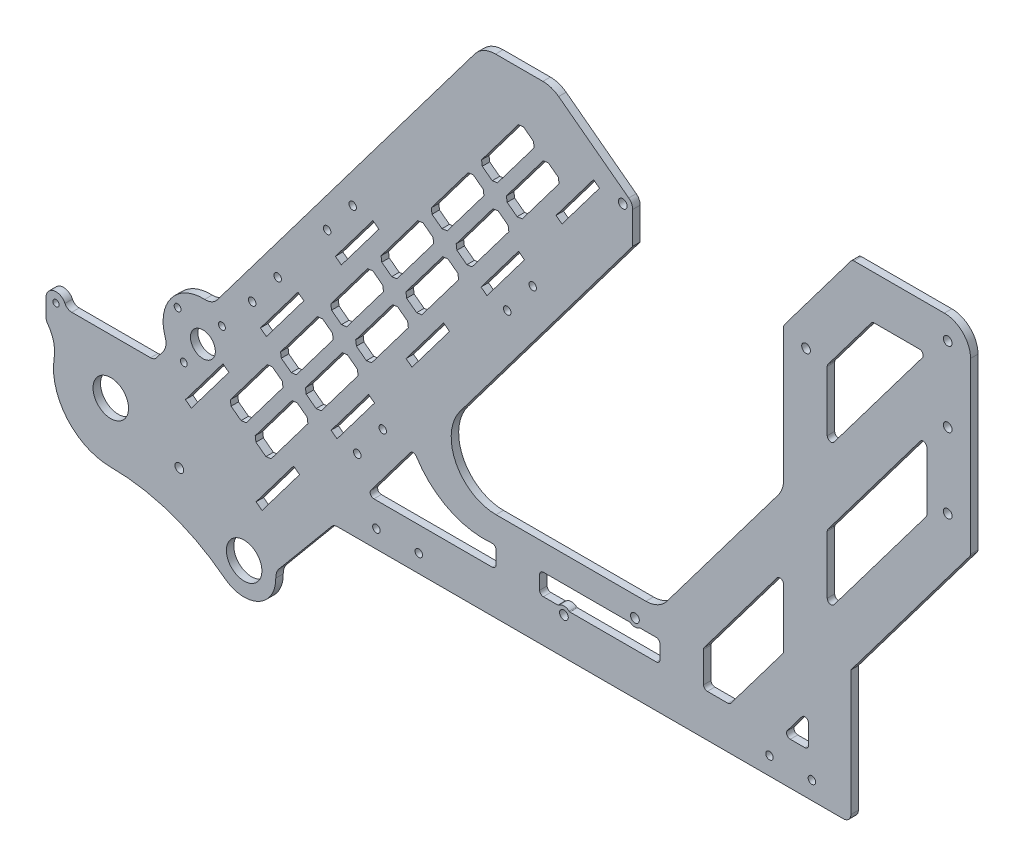
from build123d import *

# Parameters (mm, degrees)
ESBO_O1_R                 = 14.25
RESSALTO_EXTRUS_O1_DEPTH  = 6
RESSALTO_EXTRUS_O2_DEPTH  = 6
FILETE1_R                 = 12
FILETE2_R                 = 6
CORTE_EXTRUS_O1_DEPTH     = 10
FILETE3_R                 = 6
RESSALTO_EXTRUS_O3_DEPTH  = 6
ESBO_O6_R                 = 2.5
CORTE_EXTRUS_O2_DEPTH     = 10
FILETE4_R                 = 6
CORTE_EXTRUS_O3_DEPTH     = 864.46704654
ESBO_O8_R                 = 16
ESBO_O8_R_2               = 14.25
RESSALTO_EXTRUS_O4_DEPTH  = 6
CORTE_EXTRUS_O4_DEPTH     = 983.515139832
FILETE5_R                 = 55
CORTE_EXTRUS_O5_DEPTH     = 983.515139832
FILETE8_R                 = 21
RESSALTO_EXTRUS_O5_DEPTH  = 6
ESBO_O13_R                = 2.5
CORTE_EXTRUS_O7_DEPTH     = 983.515139832
CORTE_EXTRUS_O8_DEPTH     = 983.515139832
FILETE10_R                = 21
FILETE11_R                = 21
FILETE12_R                = 21
RESSALTO_EXTRUS_O6_DEPTH  = 6
FILETE13_R                = 21
CHANFRO1_SIZE             = 55
CHANFRO1_SIZE2            = 72.987465189
CORTE_EXTRUS_O10_DEPTH    = 983.515139832
FILETE15_R                = 3
RESSALTO_EXTRUS_O9_DEPTH  = 6
CORTE_EXTRUS_O12_DEPTH    = 983.515139832
FILETE16_R                = 3
ESBO_O22_W                = 96.57162865
ESBO_O22_H                = 17
CORTE_EXTRUS_O13_DEPTH    = 983.515139832
FILETE17_R                = 3
FILETE18_R                = 6
ESBO_O23_R                = 2.5
CORTE_EXTRUS_O14_DEPTH    = 983.515139832
RESSALTO_EXTRUS_O10_DEPTH = 6
FILETE19_R                = 12
ESBO_O25_R                = 10
CORTE_EXTRUS_O15_DEPTH    = 983.515139832
RESSALTO_EXTRUS_O11_DEPTH = 6
RESSALTO_EXTRUS_O12_DEPTH = 6
ESBO_O30_R                = 3.5
CORTE_EXTRUS_O17_DEPTH    = 983.515139832
ESBO_O32_R                = 3.5
CORTE_EXTRUS_O19_DEPTH    = 983.515139832
ESBO_O33_R                = 6.35
ESBO_O33_R_2              = 3.5
RESSALTO_EXTRUS_O14_DEPTH = 6
FILETE20_R                = 1
ESBO_O34_R                = 2.75
CORTE_EXTRUS_O20_DEPTH    = 983.515139832
ESBO_O35_R                = 2.75
RESSALTO_EXTRUS_O15_DEPTH = 6
ESBO_O37_R                = 3
CORTE_EXTRUS_O22_DEPTH    = 983.515139832
ESBO_O41_R                = 3.5
CORTE_EXTRUS_O26_DEPTH    = 983.515139832
ESBO_O44_R                = 16
CORTE_EXTRUS_O28_DEPTH    = 10
CORTE_EXTRUS_O29_DEPTH    = 864.46704654
ESBO_O46_R                = 3
CORTE_EXTRUS_O30_DEPTH    = 864.46704654
ESBO_O48_R                = 3.5
CORTE_EXTRUS_O31_DEPTH    = 864.46704654
CHANFRO2_SIZE             = 3


with BuildPart() as part:
    # Esboço1 → Ressalto-extrusão1 (new body)
    with BuildSketch(Plane.XY):
        with BuildLine():
            Line((0, 0), (52, 0))
            ThreePointArc((52, 0), (100.313395628, -8.084230776), (143.363260698, -31.456181952))
            ThreePointArc((143.363260698, -31.456181952), (172.156349944, -33.167061423), (183.983606557, -6.859551128))
            ThreePointArc((183.983606557, -6.859551128), (194.279022835, 32.360935307), (231, 49.560121003))
            Line((231, 49.560121003), (742, 49.560121003))
            Line((742, 49.560121003), (742, 441.560121003))
            Line((742, 441.560121003), (350.348102682, 441.560121003))
            Line((350.348102682, 441.560121003), (86.935657746, 92))
            Line((86.935657746, 92), (0, 92))
            Line((0, 92), (0, 0))
        make_face()
        with Locations((52, 48)):
            Circle(ESBO_O1_R, mode=Mode.SUBTRACT)
        with Locations((159, -11.439878997)):
            Circle(ESBO_O1_R, mode=Mode.SUBTRACT)
    extrude(amount=RESSALTO_EXTRUS_O1_DEPTH)

    # Esboço2 → Ressalto-extrusão2 (add, through all)
    with BuildSketch(Plane.XY.offset(6)):
        with BuildLine():
            Line((183.983606557, -6.859551128), (231, 49.560121003))
            ThreePointArc((231, 49.560121003), (194.279022835, 32.360935307), (183.983606557, -6.859551128))
        make_face()
    extrude(amount=-RESSALTO_EXTRUS_O2_DEPTH)

    # Filete1
    filete1_edges = [part.edges().sort_by_distance(p)[0] for p in [
        (183.983606557, -6.859551128, 3),
    ]]
    fillet(filete1_edges, radius=FILETE1_R)

    # Filete2
    filete2_edges = [part.edges().sort_by_distance(p)[0] for p in [
        (86.935657746, 92, 3),
        (231, 49.560121003, 3),
    ]]
    fillet(filete2_edges, radius=FILETE2_R)

    # Esboço3 → Corte-extrusão1 (cut)
    with BuildSketch(Plane.XY.offset(6)):
        with BuildLine():
            ThreePointArc((52, 0), (17.020473331, 16.126387664), (6.566746982, 53.198577652))
            ThreePointArc((6.566746982, 53.198577652), (5.818108209, 65.32928546), (0, 76))
            Line((0, 76), (0, 0))
            Line((0, 0), (52, 0))
        make_face()
    extrude(amount=-CORTE_EXTRUS_O1_DEPTH, mode=Mode.SUBTRACT)

    # Filete3
    filete3_edges = [part.edges().sort_by_distance(p)[0] for p in [
        (0, 76, 3),
    ]]
    fillet(filete3_edges, radius=FILETE3_R)

    # Esboço5 → Ressalto-extrusão3 (add, through all)
    with BuildSketch(Plane.XY.offset(6)):
        with BuildLine():
            Line((0, 92), (16, 92))
            ThreePointArc((16, 92), (8, 100), (0, 92))
        make_face()
    extrude(amount=-RESSALTO_EXTRUS_O3_DEPTH)

    # Esboço6 → Corte-extrusão2 (cut)
    with BuildSketch(Plane.XY.offset(6)):
        with Locations((8, 92)):
            Circle(ESBO_O6_R)
    extrude(amount=-CORTE_EXTRUS_O2_DEPTH, mode=Mode.SUBTRACT)

    # Filete4
    filete4_edges = [part.edges().sort_by_distance(p)[0] for p in [
        (16, 92, 3),
    ]]
    fillet(filete4_edges, radius=FILETE4_R)

    # Esboço7 → Corte-extrusão3 (cut, through all)
    with BuildSketch(Plane.XY.offset(6)):
        Polygon((168.599532162, 34.207607546), (198.69028332, 74.139383048), (203.48209638, 70.528492909), (173.391345223, 30.596717407), align=None)
        Polygon((228.781034478, 114.071158551), (258.871785635, 154.002934053), (263.663598695, 150.392043914), (233.572847538, 110.460268412), align=None)
        Polygon((288.962536793, 193.934709555), (319.05328795, 233.866485058), (323.845101011, 230.255594919), (293.754349853, 190.323819416), align=None)
        Polygon((349.144039108, 273.79826056), (379.234790266, 313.730036062), (384.026603326, 310.119145924), (353.935852168, 270.187370421), align=None)
        Polygon((409.325541423, 353.661811565), (439.416292581, 393.593587067), (444.208105641, 389.982696928), (414.117354483, 350.050921426), align=None)
        Polygon((111.896410949, 76.93647419), (141.987162107, 116.868249692), (146.778975167, 113.257359553), (116.688224009, 73.325584051), align=None)
        Polygon((172.077913264, 156.800025194), (202.168664422, 196.731800697), (206.960477482, 193.120910558), (176.869726324, 153.189135055), align=None)
        Polygon((232.259415579, 236.663576199), (262.350166737, 276.595351702), (267.141979797, 272.984461563), (237.05122864, 233.05268606), align=None)
    extrude(amount=-CORTE_EXTRUS_O3_DEPTH, mode=Mode.SUBTRACT)

    # Esboço9 → Corte-extrusão4 (cut, through all)
    with BuildSketch(Plane(origin=(0, 0, 0), x_dir=(-1, 0, 0), z_dir=(0, 0, -1))):
        Polygon((-592, 441.560121003), (-492, 441.560121003), (-250.862703967, 121.560121003), (-592, 121.560121003), align=None)
    extrude(amount=-CORTE_EXTRUS_O4_DEPTH, mode=Mode.SUBTRACT)

    # Filete5
    filete5_edges = [part.edges().sort_by_distance(p)[0] for p in [
        (250.862703967, 121.560121003, 3),
    ]]
    fillet(filete5_edges, radius=FILETE5_R)

    # Esboço10 → Corte-extrusão5 (cut, through all)
    with BuildSketch(Plane(origin=(0, 0, 0), x_dir=(-1, 0, 0), z_dir=(0, 0, -1))):
        with BuildLine():
            Line((-646, 49.560121003), (-742, 49.560121003))
            Line((-742, 49.560121003), (-742, 245.560121003))
            ThreePointArc((-742, 245.560121003), (-689.71858819, 217.13787766), (-646, 176.766415164))
            Line((-646, 176.766415164), (-646, 49.560121003))
        make_face()
    extrude(amount=-CORTE_EXTRUS_O5_DEPTH, mode=Mode.SUBTRACT)

    # Filete8
    filete8_edges = [part.edges().sort_by_distance(p)[0] for p in [
        (350.348102682, 441.560121003, 3),
        (742, 441.560121003, 3),
        (492, 441.560121003, 3),
    ]]
    fillet(filete8_edges, radius=FILETE8_R)

    # Esboço12 → Ressalto-extrusão5 (add, through all)
    with BuildSketch(Plane.XY.offset(6)):
        with BuildLine():
            Line((470.880516127, 420.560121003), (470.880516127, 388.554842699))
            ThreePointArc((470.880516127, 388.554842699), (467.677967693, 382.152932166), (460.634401511, 380.87662877))
            ThreePointArc((460.634401511, 380.87662877), (450.44071555, 379.947724736), (441.636873577, 374.725994882))
            Line((441.636873577, 374.725994882), (466.651861838, 407.922005517))
            ThreePointArc((466.651861838, 407.922005517), (469.795312886, 413.896723218), (470.880516127, 420.560121003))
        make_face()
    extrude(amount=-RESSALTO_EXTRUS_O5_DEPTH)

    # Esboço13 → Corte-extrusão7 (cut, through all)
    with BuildSketch(Plane.XY.offset(6)):
        with Locations((462.880516127, 388.554842699)):
            Circle(ESBO_O13_R)
    extrude(amount=-CORTE_EXTRUS_O7_DEPTH, mode=Mode.SUBTRACT)

    # Esboço14 → Corte-extrusão8 (cut, through all)
    with BuildSketch(Plane.XY.offset(6)):
        with BuildLine():
            Line((467.695036312, 394.943926779), (405.833257163, 441.560121003))
            Line((405.833257163, 441.560121003), (449.880516127, 441.560121003))
            ThreePointArc((449.880516127, 441.560121003), (464.729758531, 435.409363408), (470.880516127, 420.560121003))
            Line((470.880516127, 420.560121003), (470.880516127, 388.554842699))
            ThreePointArc((470.880516127, 388.554842699), (470.039991019, 392.124425203), (467.695036312, 394.943926779))
        make_face()
    extrude(amount=-CORTE_EXTRUS_O8_DEPTH, mode=Mode.SUBTRACT)

    # Filete10
    filete10_edges = [part.edges().sort_by_distance(p)[0] for p in [
        (405.833257163, 441.560121003, 3),
    ]]
    fillet(filete10_edges, radius=FILETE10_R)

    # Filete11
    filete11_edges = [part.edges().sort_by_distance(p)[0] for p in [
        (646, 176.766415164, 3),
    ]]
    fillet(filete11_edges, radius=FILETE11_R)

    # Filete12
    filete12_edges = [part.edges().sort_by_distance(p)[0] for p in [
        (742, 245.560121003, 3),
    ]]
    fillet(filete12_edges, radius=FILETE12_R)

    # Esboço16 → Ressalto-extrusão6 (add, through all)
    with BuildSketch(Plane.XY.offset(6)):
        Polygon((592, 254.264603165), (492, 121.560121003), (592, 121.560121003), align=None)
    extrude(amount=-RESSALTO_EXTRUS_O6_DEPTH)

    # Filete13
    filete13_edges = [part.edges().sort_by_distance(p)[0] for p in [
        (592, 254.264603165, 3),
        (492, 121.560121003, 3),
    ]]
    fillet(filete13_edges, radius=FILETE13_R)

    # Chanfro1
    chanfro1_edges = [part.edges().sort_by_distance(p)[0] for p in [
        (592, 441.560121003, 3),
    ]]
    chanfro1_side = [part.faces().sort_by_distance(p)[0] for p in [
        (656.5, 441.560121003, 3),
    ]]
    chamfer(chanfro1_edges, length=CHANFRO1_SIZE, length2=CHANFRO1_SIZE2, reference=chanfro1_side[0])

    # Esboço17 → Corte-extrusão10 (cut, through all)
    with BuildSketch(Plane.XY.offset(6)):
        Polygon((663.198220624, 406.560121003), (627, 358.523459772), (627, 300.396535273), (707, 406.560121003), align=None)
        Polygon((627, 243.900770475), (707, 350.064356205), (707, 293.568591407), (627, 187.405005677), align=None)
        Polygon((646, 106.12309249), (742, 233.519395365), (742, 283.519395365), (646, 156.12309249), align=None)
    extrude(amount=-CORTE_EXTRUS_O10_DEPTH, mode=Mode.SUBTRACT)

    # Filete15
    filete15_edges = [part.edges().sort_by_distance(p)[0] for p in [
        (592, 368.572655814, 3),
        (647, 441.560121003, 3),
        (627, 187.405005677, 3),
        (627, 243.900770475, 3),
        (707, 350.064356205, 3),
        (707, 293.568591407, 3),
        (742, 283.519395365, 3),
        (663.198220624, 406.560121003, 3),
        (707, 406.560121003, 3),
        (627, 300.396535273, 3),
        (627, 358.523459772, 3),
    ]]
    fillet(filete15_edges, radius=FILETE15_R)

    # Esboço20 → Ressalto-extrusão9 (add, through all)
    with BuildSketch(Plane.XY.offset(6)):
        Polygon((694.488580605, 220.46961229), (646, 156.12309249), (646, 192.12309249), align=None)
    extrude(amount=-RESSALTO_EXTRUS_O9_DEPTH)

    # Esboço21 → Corte-extrusão12 (cut, through all)
    with BuildSketch(Plane.XY.offset(6)):
        Polygon((592, 197.454201718), (527.747266571, 112.187944547), (527.747266571, 83.560121003), (548.747266571, 83.560121003), (592, 140.95843692), align=None)
        Polygon((591.319878949, 83.560121003), (612, 83.560121003), (612, 111.003568554), align=None)
    extrude(amount=-CORTE_EXTRUS_O12_DEPTH, mode=Mode.SUBTRACT)

    # Filete16
    filete16_edges = [part.edges().sort_by_distance(p)[0] for p in [
        (591.319878949, 83.560121003, 3),
        (612, 111.003568554, 3),
        (612, 83.560121003, 3),
        (592, 197.454201718, 3),
        (592, 140.95843692, 3),
        (548.747266571, 83.560121003, 3),
        (527.747266571, 83.560121003, 3),
        (527.747266571, 112.187944547, 3),
    ]]
    fillet(filete16_edges, radius=FILETE16_R)

    # Esboço22 → Corte-extrusão13 (cut, through all)
    with BuildSketch(Plane.XY.offset(6)):
        with BuildLine():
            Line((295.041227004, 133.874158136), (257.126880545, 83.560121003))
            Line((257.126880545, 83.560121003), (361.175637921, 83.560121003))
            Line((361.175637921, 83.560121003), (361.175637921, 100.560121003))
            ThreePointArc((361.175637921, 100.560121003), (322.80100567, 106.680933974), (295.041227004, 133.874158136))
        make_face()
        with Locations((444.461452246, 92.060121003)):
            Rectangle(ESBO_O22_W, ESBO_O22_H)
    extrude(amount=-CORTE_EXTRUS_O13_DEPTH, mode=Mode.SUBTRACT)

    # Filete17
    filete17_edges = [part.edges().sort_by_distance(p)[0] for p in [
        (295.041227004, 133.874158136, 3),
        (361.175637921, 100.560121003, 3),
        (361.175637921, 83.560121003, 3),
        (257.126880545, 83.560121003, 3),
        (396.175637921, 100.560121003, 3),
        (492.747266571, 100.560121003, 3),
        (492.747266571, 83.560121003, 3),
        (396.175637921, 83.560121003, 3),
    ]]
    fillet(filete17_edges, radius=FILETE17_R)

    # Filete18
    filete18_edges = [part.edges().sort_by_distance(p)[0] for p in [
        (646, 49.560121003, 3),
    ]]
    fillet(filete18_edges, radius=FILETE18_R)

    # Esboço23 → Corte-extrusão14 (cut, through all)
    with BuildSketch(Plane.XY.offset(6)):
        with Locations((610, 361.560121003)):
            Circle(ESBO_O23_R)
    extrude(amount=-CORTE_EXTRUS_O14_DEPTH, mode=Mode.SUBTRACT)

    # Esboço24 → Ressalto-extrusão10 (add, through all)
    with BuildSketch(Plane(origin=(0, 0, 0), x_dir=(-1, 0, 0), z_dir=(0, 0, -1))):
        with BuildLine():
            Line((-133.242554324, 153.451327309), (-98.077124114, 106.785225249))
            ThreePointArc((-98.077124114, 106.785225249), (-100.417464173, 141.604229728), (-133.242554324, 153.451327309))
        make_face()
    extrude(amount=-RESSALTO_EXTRUS_O10_DEPTH)

    # Filete19
    filete19_edges = [part.edges().sort_by_distance(p)[0] for p in [
        (133.242554324, 153.451327309, 3),
        (98.077124114, 106.785225249, 3),
    ]]
    fillet(filete19_edges, radius=FILETE19_R)

    # Esboço25 → Corte-extrusão15 (cut, through all)
    with BuildSketch(Plane.XY.offset(6)):
        with Locations((125.897786796, 122.403429417)):
            Circle(ESBO_O25_R)
    extrude(amount=-CORTE_EXTRUS_O15_DEPTH, mode=Mode.SUBTRACT)

    # Esboço26 → Ressalto-extrusão11 (add)
    with BuildSketch(Plane.XY.offset(6)):
        with BuildLine():
            Line((311.954248033, 152.019241282), (470.880516127, 362.921522375))
            Line((470.880516127, 362.921522375), (470.880516127, 388.554842699))
            ThreePointArc((470.880516127, 388.554842699), (467.677967693, 382.152932166), (460.634401511, 380.87662877))
            ThreePointArc((460.634401511, 380.87662877), (450.44071555, 379.947724736), (441.636873577, 374.725994882))
            Line((441.636873577, 374.725994882), (317.250684869, 209.659947276))
            ThreePointArc((317.250684869, 209.659947276), (306.406366905, 181.592710029), (311.954248033, 152.019241282))
        make_face()
    extrude(amount=-RESSALTO_EXTRUS_O11_DEPTH)

    # Esboço27 → Ressalto-extrusão12 (add)
    with BuildSketch(Plane.XY.offset(6)):
        with BuildLine():
            Line((332.437042037, 179.200826997), (311.954248033, 152.019241282))
            ThreePointArc((311.954248033, 152.019241282), (332.23387212, 129.790748628), (361.175637921, 121.560121003))
            ThreePointArc((361.175637921, 121.560121003), (328.971764393, 141.488482625), (332.437042037, 179.200826997))
        make_face()
    extrude(amount=-RESSALTO_EXTRUS_O12_DEPTH)

    # Esboço30 → Corte-extrusão17 (cut, through all)
    with BuildSketch(Plane.XY.offset(6)):
        with Locations((462.880516127, 388.554842699)):
            Circle(ESBO_O30_R)
        with Locations((610, 361.560121003)):
            Circle(ESBO_O30_R)
    extrude(amount=-CORTE_EXTRUS_O17_DEPTH, mode=Mode.SUBTRACT)

    # Esboço32 → Corte-extrusão19 (cut, through all)
    with BuildSketch(Plane.XY.offset(6)):
        with Locations((472.665659748, 105.546317984)):
            Circle(ESBO_O32_R)
        with Locations((415.665659748, 79.046317984)):
            Circle(ESBO_O32_R)
    extrude(amount=-CORTE_EXTRUS_O19_DEPTH, mode=Mode.SUBTRACT)

    # Esboço33 → Ressalto-extrusão14 (add, through all)
    # profile 1 of 2: a face of its own
    with BuildSketch(Plane.XY.offset(6)):
        with Locations((472.665659748, 105.546317984)):
            Circle(ESBO_O33_R)
        with Locations((472.665659748, 105.546317984)):
            Circle(ESBO_O33_R_2, mode=Mode.SUBTRACT)
    # profile 2 of 2: a face of its own
    with BuildSketch(Plane.XY.offset(6)):
        with Locations((415.665659748, 79.046317984)):
            Circle(ESBO_O33_R)
        with Locations((415.665659748, 79.046317984)):
            Circle(ESBO_O33_R_2, mode=Mode.SUBTRACT)
    extrude(amount=-RESSALTO_EXTRUS_O14_DEPTH)

    # Filete20
    filete20_edges = [part.edges().sort_by_distance(p)[0] for p in [
        (411.199332139, 83.560121003, 3),
        (420.131987356, 83.560121003, 3),
        (476.597623591, 100.560121003, 3),
        (468.733695904, 100.560121003, 3),
    ]]
    fillet(filete20_edges, radius=FILETE20_R)

    # Esboço34 → Corte-extrusão20 (cut, through all)
    with BuildSketch(Plane.XY.offset(6)):
        with Locations((105.612444841, 137.689531005)):
            Circle(ESBO_O34_R)
        with Locations((141.183888384, 142.688771372)):
            Circle(ESBO_O34_R)
        with Locations((146.183128752, 107.117327829)):
            Circle(ESBO_O34_R)
        with Locations((110.611685208, 102.118087462)):
            Circle(ESBO_O34_R)
    extrude(amount=-CORTE_EXTRUS_O20_DEPTH, mode=Mode.SUBTRACT)

    # Esboço35 → Ressalto-extrusão15 (add, through all)
    with BuildSketch(Plane.XY.offset(6)):
        with Locations((146.183128752, 107.117327829)):
            Circle(ESBO_O35_R)
    extrude(amount=-RESSALTO_EXTRUS_O15_DEPTH)

    # Esboço37 → Corte-extrusão22 (cut, through all)
    with BuildSketch(Plane.XY.offset(6)):
        with Locations((265.1625, 63.860121003)):
            Circle(ESBO_O37_R)
        with Locations((299.1625, 63.860121003)):
            Circle(ESBO_O37_R)
        with Locations((580.6625, 63.860121003)):
            Circle(ESBO_O37_R)
        with Locations((614.6625, 63.860121003)):
            Circle(ESBO_O37_R)
    extrude(amount=-CORTE_EXTRUS_O22_DEPTH, mode=Mode.SUBTRACT)

    # Esboço41 → Corte-extrusão26 (cut, through all)
    with BuildSketch(Plane(origin=(0, 0, 0), x_dir=(-1, 0, 0), z_dir=(0, 0, -1))):
        with Locations((-723.7, 423.586279348)):
            Circle(ESBO_O41_R)
        with Locations((-723.7, 363.586279348)):
            Circle(ESBO_O41_R)
        with Locations((-723.7, 303.586279348)):
            Circle(ESBO_O41_R)
    extrude(amount=-CORTE_EXTRUS_O26_DEPTH, mode=Mode.SUBTRACT)

    # Esboço45 → Corte-extrusão29 (cut, through all)
    with BuildSketch(Plane.XY.offset(6)):
        Polygon((188.258797515, 148.363261308), (217.747733649, 187.4964013), (221.949085249, 188.086862761), (229.935440349, 182.068712529), (230.52590181, 177.86736093), (201.036965675, 138.734220937), (196.835614076, 138.143759477), (188.849258975, 144.161909708), align=None)
        Polygon((237.7136214, 172.451025721), (206.419240196, 130.921979199), (219.197408357, 121.292938828), (250.491789561, 162.821985351), (249.9013281, 167.02333695), (241.914973, 173.041487182), align=None)
        Polygon((228.580404066, 201.871840481), (258.0693402, 241.004980473), (262.2706918, 241.595441934), (270.2570469, 235.577291702), (270.847508361, 231.375940103), (241.358572226, 192.242800111), (237.157220627, 191.65233865), (229.170865526, 197.670488881), align=None)
        Polygon((278.035227951, 225.959604894), (246.740846747, 184.430558372), (259.519014908, 174.801518002), (290.813396112, 216.330564524), (290.222934651, 220.531916124), (282.236579551, 226.550066355), align=None)
        Polygon((268.902010617, 255.380419654), (298.390946751, 294.513559646), (302.592298351, 295.104021107), (310.578653451, 289.085870876), (311.169114912, 284.884519276), (281.680178778, 245.751379284), (277.478827178, 245.160917823), (269.492472078, 251.179068055), align=None)
        Polygon((318.356834503, 279.468184068), (287.062453299, 237.939137545), (299.840621459, 228.310097175), (331.135002663, 269.839143697), (330.544541203, 274.040495297), (322.558186102, 280.058645528), align=None)
        Polygon((309.223617168, 308.888998827), (338.712553303, 348.02213882), (342.913904902, 348.61260028), (350.900260003, 342.594450049), (351.490721463, 338.393098449), (322.001785329, 299.259958457), (317.800433729, 298.669496996), (309.814078629, 304.687647228), align=None)
        Polygon((358.678441054, 332.976763241), (327.38405985, 291.447716718), (340.162228011, 281.818676348), (371.456609214, 323.34772287), (370.866147754, 327.54907447), (362.879792653, 333.567224702), align=None)
        Polygon((349.545223719, 362.397578), (379.034159854, 401.530717993), (383.235511453, 402.121179453), (391.221866554, 396.103029222), (391.812328014, 391.901677622), (362.32339188, 352.76853763), (358.12204028, 352.178076169), (350.13568518, 358.196226401), align=None)
        Polygon((399.000047605, 386.485342414), (367.705666401, 344.956295892), (380.483834562, 335.327255521), (411.778215766, 376.856302044), (411.187754305, 381.057653643), (403.201399204, 387.075803875), align=None)
        Polygon((147.937190963, 94.854682135), (177.426127098, 133.987822127), (181.627478697, 134.578283588), (189.613833798, 128.560133356), (190.204295259, 124.358781757), (160.715359124, 85.225641764), (156.514007524, 84.635180304), (148.527652424, 90.653330535), align=None)
        Polygon((197.392014849, 118.942446548), (166.097633645, 77.413400026), (178.875801806, 67.784359655), (210.17018301, 109.313406178), (209.579721549, 113.514757777), (201.593366449, 119.532908009), align=None)
    extrude(amount=-CORTE_EXTRUS_O29_DEPTH, mode=Mode.SUBTRACT)

    # Esboço46 → Corte-extrusão30 (cut, through all)
    with BuildSketch(Plane.XY.offset(6)):
        with Locations((390.632570934, 295.124107012)):
            Circle(ESBO_O46_R)
        with Locations((370.170860147, 267.97049967)):
            Circle(ESBO_O46_R)
        with Locations((249.807855517, 108.243397661)):
            Circle(ESBO_O46_R)
        with Locations((270.269566304, 135.397005003)):
            Circle(ESBO_O46_R)
        with Locations((165.471945656, 171.795064106)):
            Circle(ESBO_O46_R)
        with Locations((185.933656443, 198.948671447)):
            Circle(ESBO_O46_R)
        with Locations((225.653447971, 251.658615111)):
            Circle(ESBO_O46_R)
        with Locations((246.115158758, 278.812222452)):
            Circle(ESBO_O46_R)
    extrude(amount=-CORTE_EXTRUS_O30_DEPTH, mode=Mode.SUBTRACT)

    # Esboço48 → Corte-extrusão31 (cut, through all)
    with BuildSketch(Plane.XY.offset(6)):
        with Locations((107, 27)):
            Circle(ESBO_O48_R)
    extrude(amount=-CORTE_EXTRUS_O31_DEPTH, mode=Mode.SUBTRACT)

    # Chanfro2
    chanfro2_edges = [part.edges().sort_by_distance(p)[0] for p in [
        (287.062453299, 237.939137545, 3),
        (299.840621459, 228.310097175, 3),
        (166.097633645, 77.413400026, 3),
        (178.875801806, 67.784359655, 3),
        (219.197408357, 121.292938828, 3),
        (206.419240196, 130.921979199, 3),
        (246.740846747, 184.430558372, 3),
        (259.519014908, 174.801518002, 3),
        (327.38405985, 291.447716718, 3),
        (340.162228011, 281.818676348, 3),
        (367.705666401, 344.956295892, 3),
        (380.483834562, 335.327255521, 3),
    ]]
    chamfer(chanfro2_edges, length=CHANFRO2_SIZE)


with BuildPart() as body_2:
    # Esboço8 → Ressalto-extrusão4 (new body)
    with BuildSketch(Plane.XY.offset(6)):
        with Locations((711, 628)):
            Circle(ESBO_O8_R)
        with Locations((711, 628)):
            Circle(ESBO_O8_R_2, mode=Mode.SUBTRACT)
    extrude(amount=-RESSALTO_EXTRUS_O4_DEPTH)

    # Esboço44 → Corte-extrusão28 (cut)
    with BuildSketch(Plane.XY.offset(6)):
        with Locations((711, 628)):
            Circle(ESBO_O44_R)
    extrude(amount=-CORTE_EXTRUS_O28_DEPTH, mode=Mode.SUBTRACT)


solid = part.part
